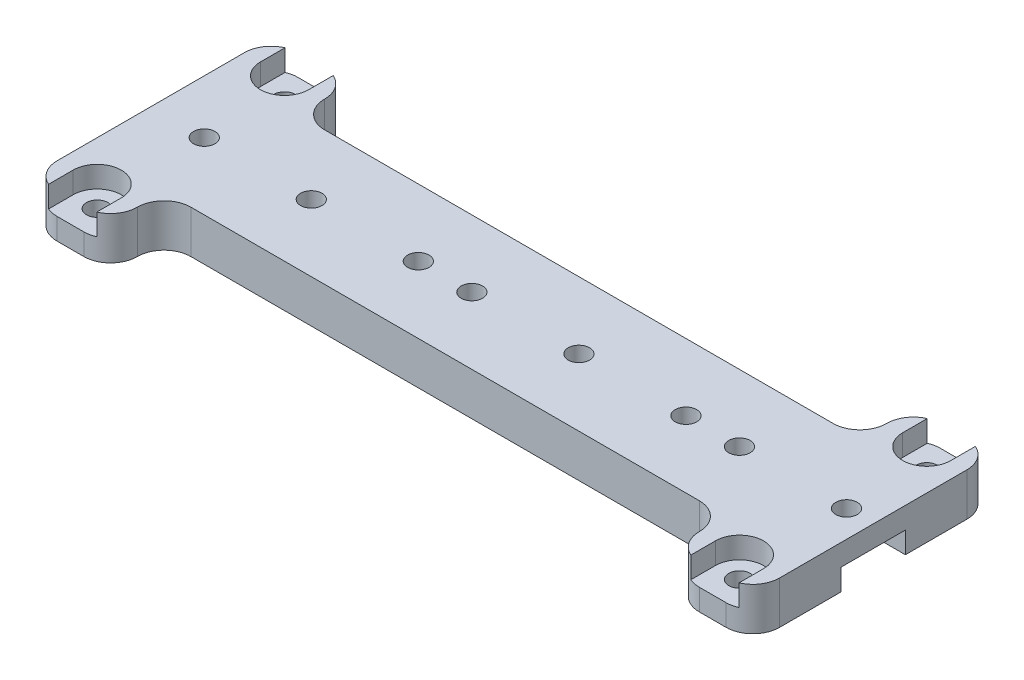
from build123d import *

# Parameters (mm, degrees)
SKETCH1_W                                  = 135
SKETCH1_H                                  = 25
BOSS_EXTRUDE1_DEPTH                        = 8
SKETCH2_W                                  = 15
SKETCH2_H                                  = 10
BOSS_EXTRUDE2_DEPTH                        = 8
FILLET1_R                                  = 5
SKETCH3_R                                  = 2
CUT_EXTRUDE1_DEPTH                         = 10
CUT_EXTRUDE2_DEPTH                         = 4
MIRROR3_AT_THE_SECOND_PLANE_COPY_1_SKETC_W = 15
MIRROR3_AT_THE_SECOND_PLANE_COPY_1_SKETC_H = 10
MIRROR3_AT_THE_SECOND_PLANE_COPY_1_DEPTH   = 8
MIRROR3_AT_THE_SECOND_PLANE_COPY_2_SKETC_R = 2
MIRROR3_AT_THE_SECOND_PLANE_COPY_2_DEPTH   = 10
MIRROR3_AT_THE_SECOND_PLANE_COPY_3_DEPTH   = 4
FILLET2_R                                  = 5
SKETCH5_R                                  = 2
CUT_EXTRUDE3_DEPTH                         = 10
SKETCH6_W                                  = 135
SKETCH6_H                                  = 12
CUT_EXTRUDE4_DEPTH                         = 4


with BuildPart() as part:
    # Sketch1 → Boss-Extrude1 (new body)
    with BuildSketch(Plane(origin=(0, 0, 0), x_dir=(1, 0, 0), z_dir=(0, 1, 0))):
        with Locations((67.5, 12.5)):
            Rectangle(SKETCH1_W, SKETCH1_H)
    extrude(amount=BOSS_EXTRUDE1_DEPTH)

    # Sketch2 → Boss-Extrude2 (add)
    with BuildSketch(Plane(origin=(0, 8, 0), x_dir=(1, 0, 0), z_dir=(0, 1, 0))):
        with Locations((7.5, 30)):
            Rectangle(SKETCH2_W, SKETCH2_H)
    boss_extrude2 = extrude(amount=-BOSS_EXTRUDE2_DEPTH)

    # Fillet1
    fillet1_edges = [part.edges().sort_by_distance(p)[0] for p in [
        (0, 4, -35),
        (15, 4, -35),
    ]]
    fillet(fillet1_edges, radius=FILLET1_R)

    # Sketch3 → Cut-Extrude1 (cut)
    with BuildSketch(Plane(origin=(0, 8, 0), x_dir=(1, 0, 0), z_dir=(0, 1, 0))):
        with Locations(Location((7.5, 30, 0), (0, 0, 270))):
            Circle(SKETCH3_R)
    cut_extrude1 = extrude(amount=-CUT_EXTRUDE1_DEPTH, mode=Mode.SUBTRACT)

    # Sketch4 → Cut-Extrude2 (cut)
    with BuildSketch(Plane(origin=(0, 8, 0), x_dir=(1, 0, 0), z_dir=(0, 1, 0))):
        with BuildLine():
            Line((3, 30), (3, 34.582575695))
            Line((3, 34.582575695), (3.751281218, 37.139462948))
            Line((3.751281218, 37.139462948), (12, 36.532200332))
            Line((12, 36.532200332), (12, 30))
            ThreePointArc((12, 30), (7.5, 25.5), (3, 30))
        make_face()
    cut_extrude2 = extrude(amount=-CUT_EXTRUDE2_DEPTH, mode=Mode.SUBTRACT)

    # Mirror3: Boss-Extrude2, Cut-Extrude1, Cut-Extrude2 across plane
    add(boss_extrude2.mirror(Plane.XY.offset(-12.5)))
    add(cut_extrude1.mirror(Plane.XY.offset(-12.5)), mode=Mode.SUBTRACT)
    add(cut_extrude2.mirror(Plane.XY.offset(-12.5)), mode=Mode.SUBTRACT)

    # Mirror3 at the second plane: Boss-Extrude2, Cut-Extrude1, Cut-Extrude2 across plane
    add(boss_extrude2.mirror(Plane.ZY.offset(-67.5)))
    add(cut_extrude1.mirror(Plane.ZY.offset(-67.5)), mode=Mode.SUBTRACT)
    add(cut_extrude2.mirror(Plane.ZY.offset(-67.5)), mode=Mode.SUBTRACT)

    # Mirror3 at the second plane copy 1 sketc → Mirror3 at the second plane copy 1 (add)
    with BuildSketch(Plane(origin=(135, 8, -25), x_dir=(-1, 0, 0), z_dir=(0, 1, 0))):
        with Locations((7.5, 30)):
            Rectangle(MIRROR3_AT_THE_SECOND_PLANE_COPY_1_SKETC_W, MIRROR3_AT_THE_SECOND_PLANE_COPY_1_SKETC_H)
    extrude(amount=-MIRROR3_AT_THE_SECOND_PLANE_COPY_1_DEPTH)

    # Mirror3 at the second plane copy 2 sketc → Mirror3 at the second plane copy 2 (cut)
    with BuildSketch(Plane(origin=(135, 8, -25), x_dir=(-1, 0, 0), z_dir=(0, 1, 0))):
        with Locations(Location((7.5, 30, 0), (0, 0, 270))):
            Circle(MIRROR3_AT_THE_SECOND_PLANE_COPY_2_SKETC_R)
    extrude(amount=-MIRROR3_AT_THE_SECOND_PLANE_COPY_2_DEPTH, mode=Mode.SUBTRACT)

    # Mirror3 at the second plane copy 3 sketc → Mirror3 at the second plane copy 3 (cut)
    with BuildSketch(Plane(origin=(135, 8, -25), x_dir=(-1, 0, 0), z_dir=(0, 1, 0))):
        with BuildLine():
            Line((3, 30), (3, 34.582575695))
            Line((3, 34.582575695), (3.751281218, 37.139462948))
            Line((3.751281218, 37.139462948), (12, 36.532200332))
            Line((12, 36.532200332), (12, 30))
            ThreePointArc((12, 30), (7.5, 25.5), (3, 30))
        make_face()
    extrude(amount=-MIRROR3_AT_THE_SECOND_PLANE_COPY_3_DEPTH, mode=Mode.SUBTRACT)

    # Fillet2
    fillet2_edges = [part.edges().sort_by_distance(p)[0] for p in [
        (15, 4, -25),
        (120, 4, -35),
        (120, 4, -25),
        (135, 4, -35),
        (15, 4, 10),
        (15, 4, 0),
        (0, 4, 10),
        (135, 4, 10),
        (120, 4, 10),
        (120, 4, 0),
    ]]
    fillet(fillet2_edges, radius=FILLET2_R - 0.0001)  # a hair under: the kernel refuses the full size

    # Sketch5 → Cut-Extrude3 (cut)
    with BuildSketch(Plane(origin=(0, 8, 0), x_dir=(1, 0, 0), z_dir=(0, 1, 0))):
        with Locations(Location((10, 12.5, 0), (0, 0, 270))):
            Circle(SKETCH5_R)
        with Locations(Location((30, 12.5, 0), (0, 0, 270))):
            Circle(SKETCH5_R)
        with Locations(Location((50, 12.5, 0), (0, 0, 270))):
            Circle(SKETCH5_R)
        with Locations(Location((60, 12.5, 0), (0, 0, 270))):
            Circle(SKETCH5_R)
        with Locations(Location((80, 12.5, 0), (0, 0, 270))):
            Circle(SKETCH5_R)
        with Locations(Location((100, 12.5, 0), (0, 0, 270))):
            Circle(SKETCH5_R)
        with Locations(Location((110, 12.5, 0), (0, 0, 270))):
            Circle(SKETCH5_R)
        with Locations(Location((130, 12.5, 0), (0, 0, 270))):
            Circle(SKETCH5_R)
    extrude(amount=-CUT_EXTRUDE3_DEPTH, mode=Mode.SUBTRACT)

    # Sketch6 → Cut-Extrude4 (cut)
    with BuildSketch(Plane.XZ):
        with Locations((67.5, -12.5)):
            Rectangle(SKETCH6_W, SKETCH6_H)
    extrude(amount=-CUT_EXTRUDE4_DEPTH, mode=Mode.SUBTRACT)


solid = part.part
